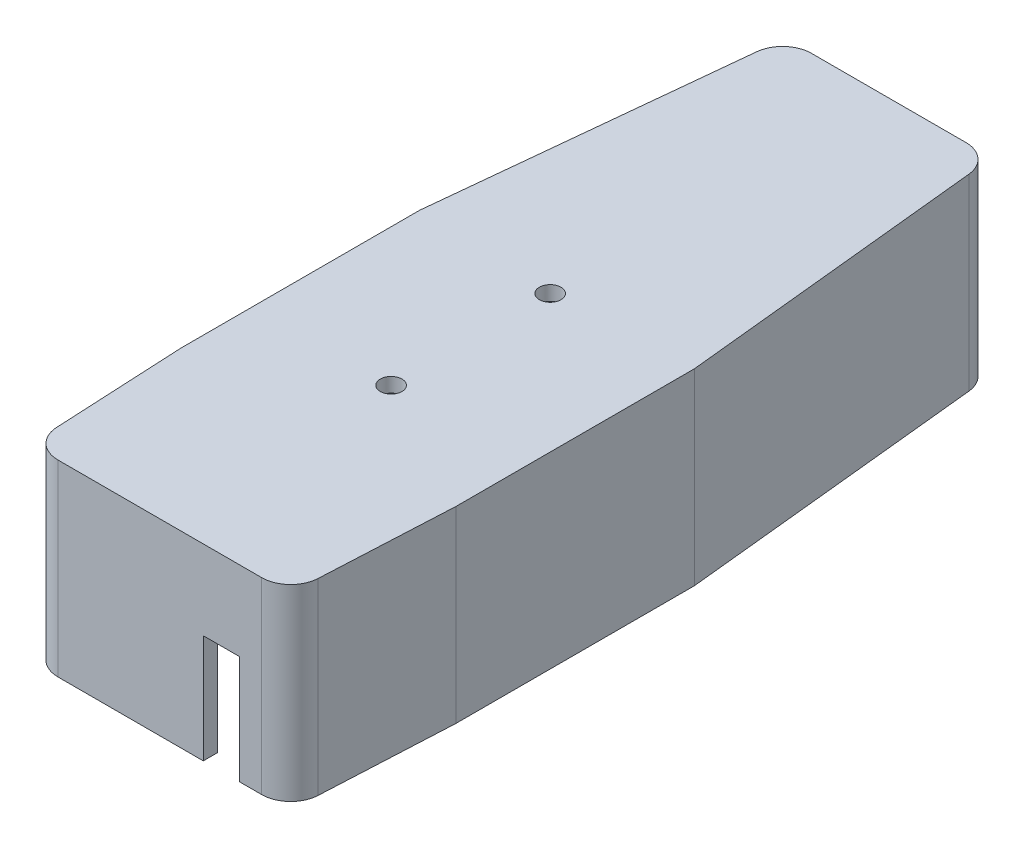
from build123d import *

# Parameters (mm, degrees)
BOSS_EXTRUDE1_DEPTH = 26
SHELL1_T            = -2
SKETCH3_W           = 5
SKETCH3_H           = 15
CUT_EXTRUDE1_DEPTH  = 5
SKETCH4_R           = 1.5
CUT_EXTRUDE2_DEPTH  = 10
BOSS_EXTRUDE2_DEPTH = 3
SKETCH7_R           = 1.397
CUT_EXTRUDE3_DEPTH  = 5
SKETCH8_R           = 1.397
CUT_EXTRUDE4_DEPTH  = 5


with BuildPart() as part:
    # Sketch1 → Boss-Extrude1 (new body)
    with BuildSketch(Plane(origin=(0, 0, 0), x_dir=(1, 0, 0), z_dir=(0, 1, 0))):
        with BuildLine():
            Line((6.305887047, 78.84802453), (27.694112953, 78.84802453))
            ThreePointArc((27.694112953, 78.84802453), (30.374796425, 77.816851929), (31.673356222, 75.254992592))
            Line((31.673356222, 75.254992592), (36, 32.950031211))
            Line((36, 32.950031211), (36, -0.049968789))
            Line((36, -0.049968789), (35.092510916, -18.199750468))
            ThreePointArc((35.092510916, -18.199750468), (33.854401824, -20.898189251), (31.097501561, -22))
            Line((31.097501561, -22), (2.902498439, -22))
            ThreePointArc((2.902498439, -22), (0.145598176, -20.898189251), (-1.092510916, -18.199750468))
            Line((-1.092510916, -18.199750468), (-2, -0.049968789))
            Line((-2, -0.049968789), (-2, 32.950031211))
            Line((-2, 32.950031211), (2.326643778, 75.254992592))
            ThreePointArc((2.326643778, 75.254992592), (3.625203575, 77.816851929), (6.305887047, 78.84802453))
        make_face()
    extrude(amount=BOSS_EXTRUDE1_DEPTH)

    # Shell1
    shell1_openings = [part.faces().sort_by_distance(p)[0] for p in [
        (17, 0, -26.610641327),
    ]]
    offset(amount=SHELL1_T, openings=shell1_openings, kind=Kind.INTERSECTION)

    # Sketch3 → Cut-Extrude1 (cut)
    with BuildSketch(Plane.XY.offset(22)):
        with Locations((25.508858148, 7.5)):
            Rectangle(SKETCH3_W, SKETCH3_H)
    extrude(amount=-CUT_EXTRUDE1_DEPTH, mode=Mode.SUBTRACT)

    # Sketch4 → Cut-Extrude2 (cut)
    with BuildSketch(Plane.XZ.offset(-24)):
        with Locations((17, -10)):
            Circle(SKETCH4_R)
        with Locations((17, -32)):
            Circle(SKETCH4_R)
    extrude(amount=-CUT_EXTRUDE2_DEPTH, mode=Mode.SUBTRACT)

    # Sketch5 → Boss-Extrude2 (add)
    with BuildSketch(Plane.XZ):
        with BuildLine():
            Line((30.522727273, -66.84802453), (3.477272727, -66.84802453))
            Line((3.477272727, -66.84802453), (4.316265412, -75.051508561))
            ThreePointArc((4.316265412, -75.051508561), (4.965545311, -76.332438229), (6.305887047, -76.84802453))
            Line((6.305887047, -76.84802453), (27.694112953, -76.84802453))
            ThreePointArc((27.694112953, -76.84802453), (29.034454689, -76.332438229), (29.683734588, -75.051508561))
            Line((29.683734588, -75.051508561), (30.522727273, -66.84802453))
        make_face()
    extrude(amount=-BOSS_EXTRUDE2_DEPTH)

    # Sketch7 → Cut-Extrude3 (cut)
    with BuildSketch(Plane.XZ):
        with Locations((24.335511696, -71.84802453)):
            Circle(SKETCH7_R)
    extrude(amount=-CUT_EXTRUDE3_DEPTH, mode=Mode.SUBTRACT)

    # Sketch8 → Cut-Extrude4 (cut)
    with BuildSketch(Plane.XZ):
        with Locations((9.336175071, -71.84802453)):
            Circle(SKETCH8_R)
    extrude(amount=-CUT_EXTRUDE4_DEPTH, mode=Mode.SUBTRACT)


solid = part.part
